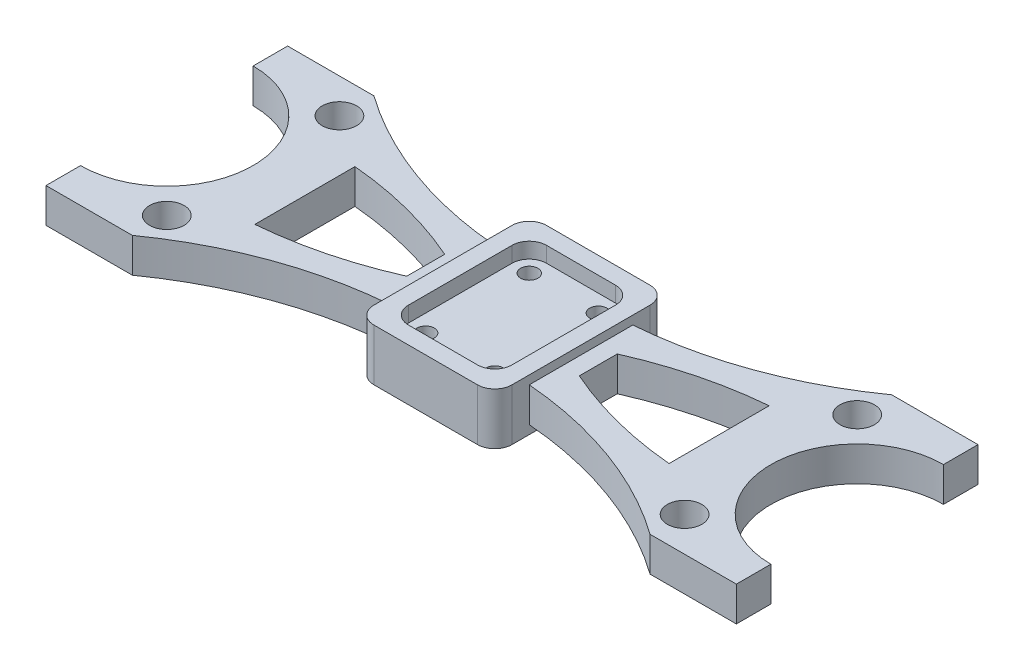
from build123d import *

# Parameters (mm, degrees)
SKETCH1_R             = 5
BOSS_EXTRUDE1_DEPTH   = 5
BOSS_EXTRUDE1_2_DEPTH = 5
SKETCH1_3_R           = 2.5
BOSS_EXTRUDE2_DEPTH   = 3
BOSS_EXTRUDE3_DEPTH   = 7.5


with BuildPart() as part:
    # Sketch1 → Boss-Extrude1 (new, symmetric)
    with BuildSketch(Plane(origin=(0, 0, 0), x_dir=(1, 0, 0), z_dir=(0, 1, 0))):
        with BuildLine():
            ThreePointArc((-75, -35), (-48.85448144, -21.27517604), (-20, -15))
            Line((-20, -15), (-20, 15))
            ThreePointArc((-20, 15), (-48.85448144, 21.27517604), (-75, 35))
            Line((-75, 35), (-100, 35))
            Line((-100, 35), (-100, 25))
            ThreePointArc((-100, 25), (-75, 0), (-100, -25))
            Line((-100, -25), (-100, -35))
            Line((-100, -35), (-75, -35))
        make_face()
        with Locations((-75, -25)):
            Circle(SKETCH1_R, mode=Mode.SUBTRACT)
        with BuildLine():
            Line((-60, -14.5), (-60, 14.5))
            ThreePointArc((-60, 14.5), (-42.12787297, 11.447160671), (-25, 5.5))
            Line((-25, 5.5), (-25, -5.5))
            ThreePointArc((-25, -5.5), (-42.12787297, -11.447160671), (-60, -14.5))
        make_face(mode=Mode.SUBTRACT)
        with Locations((-75, 25)):
            Circle(SKETCH1_R, mode=Mode.SUBTRACT)
    extrude(amount=BOSS_EXTRUDE1_DEPTH, both=True)



with BuildPart() as body_2:
    # Sketch1 → Boss-Extrude1 2 (new, symmetric)
    with BuildSketch(Plane(origin=(0, 0, 0), x_dir=(1, 0, 0), z_dir=(0, 1, 0))):
        with BuildLine():
            Line((20, 15), (20, -15))
            ThreePointArc((20, -15), (48.85448144, -21.27517604), (75, -35))
            Line((75, -35), (100, -35))
            Line((100, -35), (100, -25))
            ThreePointArc((100, -25), (75, 0), (100, 25))
            Line((100, 25), (100, 35))
            Line((100, 35), (75, 35))
            ThreePointArc((75, 35), (48.85448144, 21.27517604), (20, 15))
        make_face()
        with Locations((75, -25)):
            Circle(SKETCH1_R, mode=Mode.SUBTRACT)
        with BuildLine():
            ThreePointArc((60, -14.5), (42.12787297, -11.447160671), (25, -5.5))
            Line((25, -5.5), (25, 5.5))
            ThreePointArc((25, 5.5), (42.12787297, 11.447160671), (60, 14.5))
            Line((60, 14.5), (60, -14.5))
        make_face(mode=Mode.SUBTRACT)
        with Locations((75, 25)):
            Circle(SKETCH1_R, mode=Mode.SUBTRACT)
    extrude(amount=BOSS_EXTRUDE1_2_DEPTH, both=True)


with BuildPart() as body_3:
    # Sketch1<3> → Boss-Extrude2 (new, symmetric)
    with BuildSketch(Plane(origin=(0, 0, 0), x_dir=(1, 0, 0), z_dir=(0, 1, 0))):
        with BuildLine():
            ThreePointArc((-10, 20), (-13.535533906, 18.535533906), (-15, 15))
            Line((-15, 15), (-15, -15))
            ThreePointArc((-15, -15), (-13.535533906, -18.535533906), (-10, -20))
            Line((-10, -20), (10, -20))
            ThreePointArc((10, -20), (13.535533906, -18.535533906), (15, -15))
            Line((15, -15), (15, 15))
            ThreePointArc((15, 15), (13.535533906, 18.535533906), (10, 20))
            Line((10, 20), (-10, 20))
        make_face()
        with Locations((-10, -15)):
            Circle(SKETCH1_3_R, mode=Mode.SUBTRACT)
        with Locations((-10, 15)):
            Circle(SKETCH1_3_R, mode=Mode.SUBTRACT)
        with Locations((10, -15)):
            Circle(SKETCH1_3_R, mode=Mode.SUBTRACT)
        with Locations((10, 15)):
            Circle(SKETCH1_3_R, mode=Mode.SUBTRACT)
    extrude(amount=BOSS_EXTRUDE2_DEPTH, both=True)


with BuildPart() as part_1:
    add(part.part)

    add(body_2.part)  # Boss-Extrude3 merges body 2

    add(body_3.part)  # Boss-Extrude3 merges body 3
    # Sketch1<4> → Boss-Extrude3 (add, symmetric)
    with BuildSketch(Plane(origin=(0, 0, 0), x_dir=(1, 0, 0), z_dir=(0, 1, 0))):
        with BuildLine():
            Line((-15, -25), (15, -25))
            ThreePointArc((15, -25), (18.535533906, -23.535533906), (20, -20))
            Line((20, -20), (20, 20))
            ThreePointArc((20, 20), (18.535533906, 23.535533906), (15, 25))
            Line((15, 25), (-15, 25))
            ThreePointArc((-15, 25), (-18.535533906, 23.535533906), (-20, 20))
            Line((-20, 20), (-20, -20))
            ThreePointArc((-20, -20), (-18.535533906, -23.535533906), (-15, -25))
        make_face()
        with BuildLine():
            ThreePointArc((-15, 15), (-13.535533906, 18.535533906), (-10, 20))
            Line((-10, 20), (10, 20))
            ThreePointArc((10, 20), (13.535533906, 18.535533906), (15, 15))
            Line((15, 15), (15, -15))
            ThreePointArc((15, -15), (13.535533906, -18.535533906), (10, -20))
            Line((10, -20), (-10, -20))
            ThreePointArc((-10, -20), (-13.535533906, -18.535533906), (-15, -15))
            Line((-15, -15), (-15, 15))
        make_face(mode=Mode.SUBTRACT)
    extrude(amount=BOSS_EXTRUDE3_DEPTH, both=True)


solid = part_1.part
